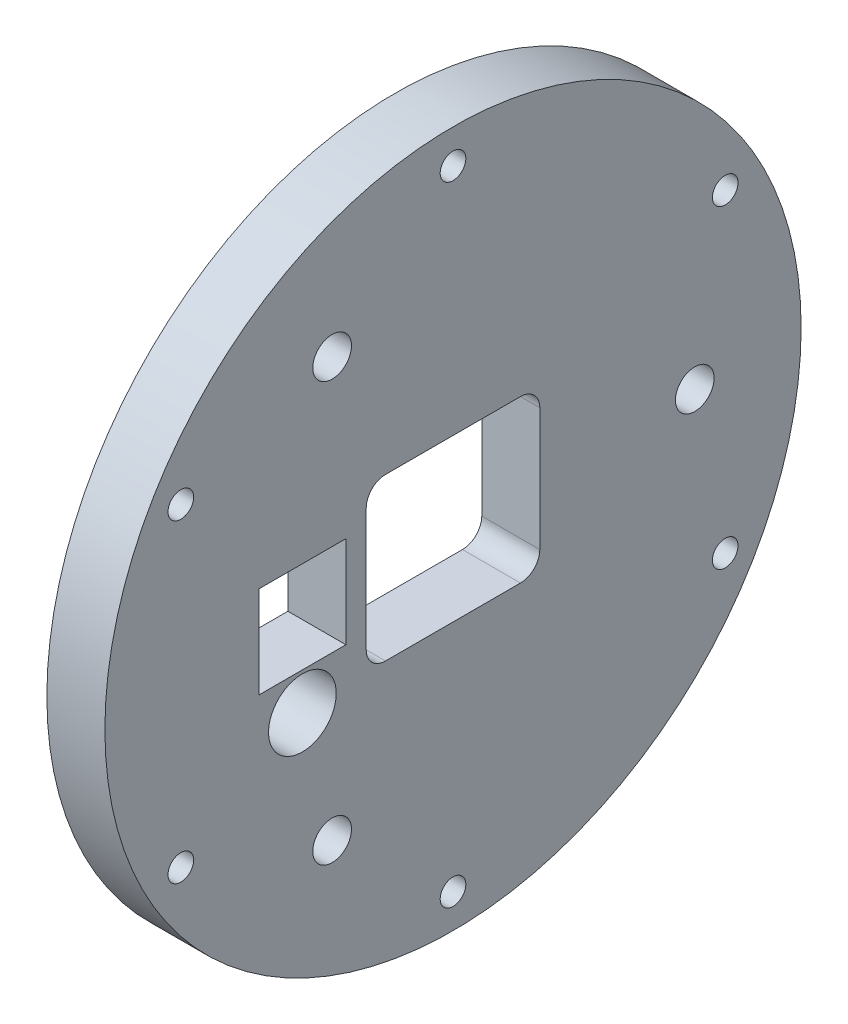
from build123d import *

# Parameters (mm, degrees)
SKETCH4_R           = 72
BOSS_EXTRUDE3_DEPTH = 12
SKETCH3_R           = 4
CUT_EXTRUDE6_DEPTH  = 103.528044944
SKETCH2_R           = 2.65
CUT_EXTRUDE1_DEPTH  = 103.528044944
SKETCH1_R           = 7
SKETCH1_W           = 18
SKETCH1_H           = 19
GOPRO_DEPTH         = 103.528044944


with BuildPart() as part:
    # Sketch4 → Boss-Extrude3 (new body)
    with BuildSketch(Plane(origin=(0, 0, 0), x_dir=(0, 0, -1), z_dir=(1, 0, 0))):
        Circle(SKETCH4_R)
    extrude(amount=BOSS_EXTRUDE3_DEPTH)

    # Sketch3 → Cut-Extrude6 (cut, through all)
    with BuildSketch(Plane(origin=(0, 0, 0), x_dir=(0, 0, -1), z_dir=(1, 0, 0))):
        with Locations((50, 0)):
            Circle(SKETCH3_R)
        with Locations((-25, -43.301270189)):
            Circle(SKETCH3_R)
        with Locations((-25, 43.301270189)):
            Circle(SKETCH3_R)
    extrude(amount=CUT_EXTRUDE6_DEPTH, mode=Mode.SUBTRACT)

    # Sketch2 → Cut-Extrude1 (cut, through all)
    with BuildSketch(Plane(origin=(0, 0, 0), x_dir=(0, 0, -1), z_dir=(1, 0, 0))):
        with Locations((0, 65)):
            Circle(SKETCH2_R)
        with Locations((56.291651246, 32.5)):
            Circle(SKETCH2_R)
        with Locations((56.291651246, -32.5)):
            Circle(SKETCH2_R)
        with Locations((0, -65)):
            Circle(SKETCH2_R)
        with Locations((-56.291651246, -32.5)):
            Circle(SKETCH2_R)
        with Locations((-56.291651246, 32.5)):
            Circle(SKETCH2_R)
    extrude(amount=CUT_EXTRUDE1_DEPTH, mode=Mode.SUBTRACT)

    # Sketch1 → gopro (cut, through all)
    with BuildSketch(Plane(origin=(0, 0, 0), x_dir=(0, 0, -1), z_dir=(1, 0, 0))):
        with Locations((-31.15, -17.4)):
            Circle(SKETCH1_R)
        with BuildLine():
            Line((-13.95, 16.7), (13.95, 16.7))
            ThreePointArc((13.95, 16.7), (16.778427125, 15.528427125), (17.95, 12.7))
            Line((17.95, 12.7), (17.95, -12.7))
            ThreePointArc((17.95, -12.7), (16.778427125, -15.528427125), (13.95, -16.7))
            Line((13.95, -16.7), (-13.95, -16.7))
            ThreePointArc((-13.95, -16.7), (-16.778427125, -15.528427125), (-17.95, -12.7))
            Line((-17.95, -12.7), (-17.95, 12.7))
            ThreePointArc((-17.95, 12.7), (-16.778427125, 15.528427125), (-13.95, 16.7))
        make_face()
        with Locations((-31.15, -0.2)):
            Rectangle(SKETCH1_W, SKETCH1_H)
    extrude(amount=GOPRO_DEPTH, mode=Mode.SUBTRACT)


solid = part.part
